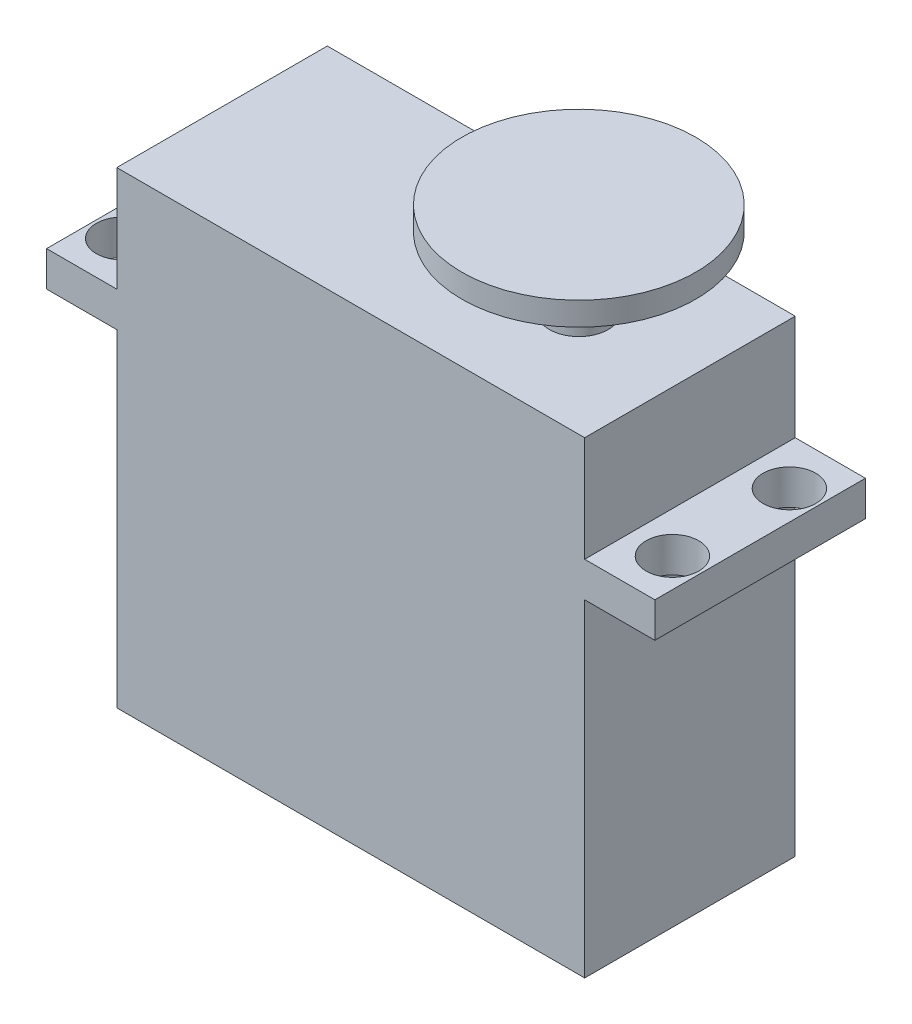
from build123d import *

# Parameters (mm, degrees)
SKETCH1_W           = 40
SKETCH1_H           = 18
BOSS_EXTRUDE1_DEPTH = 40
SKETCH2_W           = 6
SKETCH2_H           = 18
BOSS_EXTRUDE2_DEPTH = 3
SKETCH3_R           = 2.5
BOSS_EXTRUDE3_DEPTH = 6
SKETCH4_R           = 10
BOSS_EXTRUDE4_DEPTH = 2
CUT_EXTRUDE1_REACH  = 60.634
SKETCH5_R           = 2.25


with BuildPart() as part:
    # Sketch1 → Boss-Extrude1 (new body)
    with BuildSketch(Plane(origin=(0, 0, 0), x_dir=(1, 0, 0), z_dir=(0, 1, 0))):
        with Locations((20, 9)):
            Rectangle(SKETCH1_W, SKETCH1_H)
    extrude(amount=BOSS_EXTRUDE1_DEPTH)

    # Sketch2 → Boss-Extrude2 (add)
    with BuildSketch(Plane(origin=(0, 28, 0), x_dir=(-1, 0, 0), z_dir=(0, -1, 0))):
        with Locations((-43, 9)):
            Rectangle(SKETCH2_W, SKETCH2_H)
        with Locations((3, 9)):
            Rectangle(SKETCH2_W, SKETCH2_H)
    extrude(amount=-BOSS_EXTRUDE2_DEPTH)

    # Sketch3 → Boss-Extrude3 (add)
    with BuildSketch(Plane(origin=(0, 40, 0), x_dir=(1, 0, 0), z_dir=(0, 1, 0))):
        with Locations((30.5, 9)):
            Circle(SKETCH3_R)
    extrude(amount=BOSS_EXTRUDE3_DEPTH)

    # Sketch4 → Boss-Extrude4 (add)
    with BuildSketch(Plane(origin=(0, 46, 0), x_dir=(1, 0, 0), z_dir=(0, 1, 0))):
        with Locations((30.5, 9)):
            Circle(SKETCH4_R)
    extrude(amount=BOSS_EXTRUDE4_DEPTH)

    # Sketch5 → Cut-Extrude1 (cut, up to next)
    with BuildSketch(Plane(origin=(0, 31, 0), x_dir=(1, 0, 0), z_dir=(0, 1, 0)), mode=Mode.PRIVATE) as cut_extrude1_sk1:
        with Locations((-3.5, 14)):
            Circle(SKETCH5_R)
    cut_extrude1_tool1 = extrude(cut_extrude1_sk1.sketch, amount=-CUT_EXTRUDE1_REACH, mode=Mode.PRIVATE) & part.part
    # Sketch5 → Cut-Extrude1 (cut, up to next)
    with BuildSketch(Plane(origin=(0, 31, 0), x_dir=(1, 0, 0), z_dir=(0, 1, 0)), mode=Mode.PRIVATE) as cut_extrude1_sk2:
        with Locations((-3.5, 4)):
            Circle(SKETCH5_R)
    cut_extrude1_tool2 = extrude(cut_extrude1_sk2.sketch, amount=-CUT_EXTRUDE1_REACH, mode=Mode.PRIVATE) & part.part
    cut_extrude1_1 = cut_extrude1_tool1.solids().sort_by_distance((-3.5, 31, -14))[0]
    add(cut_extrude1_1, mode=Mode.SUBTRACT)
    cut_extrude1_2 = cut_extrude1_tool2.solids().sort_by_distance((-3.5, 31, -4))[0]
    add(cut_extrude1_2, mode=Mode.SUBTRACT)
    cut_extrude1 = cut_extrude1_1 + cut_extrude1_2  # Cut-Extrude1 as one shape, for the pattern or mirror that repeats it

    # Mirror1: Cut-Extrude1 across plane
    add(cut_extrude1.mirror(Plane.ZY.offset(-20)), mode=Mode.SUBTRACT)


solid = part.part
